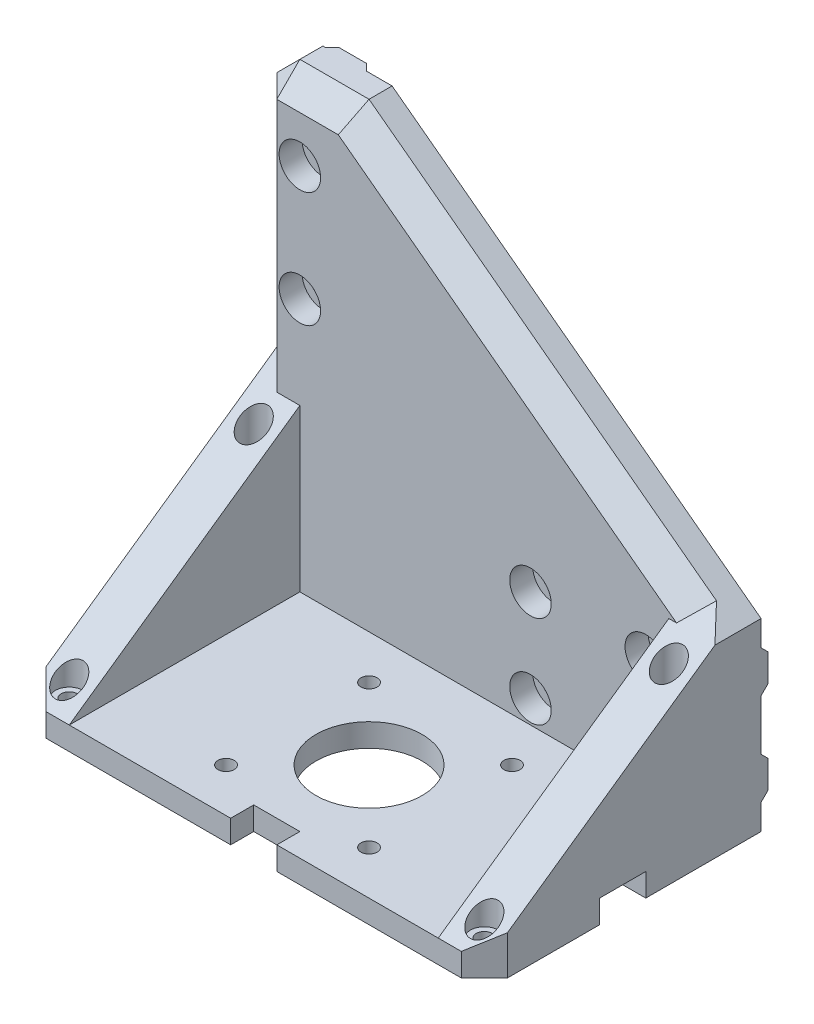
from build123d import *

# Parameters (mm, degrees)
BOSS_EXTRUDE1_DEPTH     = 10
SKETCH2_R               = 2.6
CUT_EXTRUDE1_DEPTH      = 142.774468788
SKETCH3_W               = 60
SKETCH3_H               = 9
SKETCH3_W_2             = 9
SKETCH3_H_2             = 60
BOSS_EXTRUDE3_DEPTH     = 1.46
CUT_EXTRUDE2_DEPTH      = 142.774468788
CUT_EXTRUDE2_DEPTH_BACK = 142.774468788
SKETCH2_2_R             = 2.6
CHAMFER1_SIZE           = 1.46
CUT_EXTRUDE3_START      = 10
SKETCH4_R               = 4.5
CUT_EXTRUDE3_DEPTH      = 5
SKETCH5_W               = 100
SKETCH5_H               = 50
SKETCH5_R               = 11.5
SKETCH5_R_2             = 1.75
BOSS_EXTRUDE4_DEPTH     = 5
BOSS_EXTRUDE5_DEPTH     = 10
BOSS_EXTRUDE6_START     = 100
BOSS_EXTRUDE6_DEPTH     = 10
CUT_EXTRUDE4_DEPTH      = 154.622914957
CUT_EXTRUDE4_DEPTH_BACK = 154.622914957
SKETCH9_R               = 1.75
SKETCH10_W              = 10
SKETCH10_H              = 5
CUT_EXTRUDE5_DEPTH      = 5
CUT_EXTRUDE6_START      = 100
SKETCH10_2_W            = 10
SKETCH10_2_H            = 5
CUT_EXTRUDE6_DEPTH      = 5
CUT_EXTRUDE7_START      = 60
SKETCH11_W              = 10
SKETCH11_H              = 5
CUT_EXTRUDE7_DEPTH      = 5
CUT_EXTRUDE9_START      = 100
SKETCH12_R              = 3
CUT_EXTRUDE9_DEPTH      = 95
CHAMFER2_SIZE           = 5


# Some blends are built 0.0001 mm under size
with BuildPart() as part:
    # Sketch1 → Boss-Extrude1 (new body)
    with BuildSketch(Plane.XY):
        Polygon((0, 0), (100, 0), (100, 40), (20, 100), (0, 100), align=None)
    extrude(amount=BOSS_EXTRUDE1_DEPTH)

    # Sketch2 → Cut-Extrude1 (cut, through all)
    with BuildSketch(Plane.XY):
        with Locations((10, 85)):
            Circle(SKETCH2_R)
        with Locations((10, 60)):
            Circle(SKETCH2_R)
        with Locations((85, 30)):
            Circle(SKETCH2_R)
        with Locations((85, 10)):
            Circle(SKETCH2_R)
        with Locations((60, 10)):
            Circle(SKETCH2_R)
        with Locations((60, 30)):
            Circle(SKETCH2_R)
    extrude(amount=CUT_EXTRUDE1_DEPTH, mode=Mode.SUBTRACT)

    # Sketch3 → Boss-Extrude3 (add)
    with BuildSketch(Plane.XY):
        with Locations((70, 30)):
            Rectangle(SKETCH3_W, SKETCH3_H)
        with Locations((70, 10)):
            Rectangle(SKETCH3_W, SKETCH3_H)
        with Locations((10, 70)):
            Rectangle(SKETCH3_W_2, SKETCH3_H_2)
    extrude(amount=-BOSS_EXTRUDE3_DEPTH)

    # Sketch2<2> → Cut-Extrude2 (cut, two sides: drawn at the far end of the back side and taken through both)
    with BuildSketch(Plane.XY.offset(-CUT_EXTRUDE2_DEPTH_BACK)):
        with Locations((10, 85)):
            Circle(SKETCH2_2_R)
        with Locations((10, 60)):
            Circle(SKETCH2_2_R)
        with Locations((85, 30)):
            Circle(SKETCH2_2_R)
        with Locations((85, 10)):
            Circle(SKETCH2_2_R)
        with Locations((60, 10)):
            Circle(SKETCH2_2_R)
        with Locations((60, 30)):
            Circle(SKETCH2_2_R)
    extrude(amount=CUT_EXTRUDE2_DEPTH + CUT_EXTRUDE2_DEPTH_BACK, mode=Mode.SUBTRACT)

    # Chamfer1
    chamfer1_edges = [part.edges().sort_by_distance(p)[0] for p in [
        (14.5, 70, -1.46),
        (5.5, 70, -1.46),
        (70, 5.5, -1.46),
        (70, 14.5, -1.46),
        (70, 25.5, -1.46),
        (70, 34.5, -1.46),
    ]]
    chamfer(chamfer1_edges, length=CHAMFER1_SIZE - 0.0001)  # a hair under: the kernel refuses the full size

    # Sketch4 → Cut-Extrude3 (cut)
    with BuildSketch(Plane.XY.offset(CUT_EXTRUDE3_START)):
        with Locations((10, 85)):
            Circle(SKETCH4_R)
        with Locations((10, 60)):
            Circle(SKETCH4_R)
        with Locations((60, 30)):
            Circle(SKETCH4_R)
        with Locations((85, 30)):
            Circle(SKETCH4_R)
        with Locations((85, 10)):
            Circle(SKETCH4_R)
        with Locations((60, 10)):
            Circle(SKETCH4_R)
    extrude(amount=-CUT_EXTRUDE3_DEPTH, mode=Mode.SUBTRACT)

    # Sketch5 → Boss-Extrude4 (add)
    with BuildSketch(Plane(origin=(0, 0, 0), x_dir=(1, 0, 0), z_dir=(0, 1, 0))):
        with Locations((50, -35)):
            Rectangle(SKETCH5_W, SKETCH5_H)
        with Locations(Location((50, -35, 0), (0, 0, 270))):
            Circle(SKETCH5_R, mode=Mode.SUBTRACT)
        with Locations(Location((65.5, -50.5, 0), (0, 0, 270))):
            Circle(SKETCH5_R_2, mode=Mode.SUBTRACT)
        with Locations(Location((34.5, -50.5, 0), (0, 0, 270))):
            Circle(SKETCH5_R_2, mode=Mode.SUBTRACT)
        with Locations(Location((34.5, -19.5, 0), (0, 0, 270))):
            Circle(SKETCH5_R_2, mode=Mode.SUBTRACT)
        with Locations(Location((65.5, -19.5, 0), (0, 0, 270))):
            Circle(SKETCH5_R_2, mode=Mode.SUBTRACT)
    extrude(amount=BOSS_EXTRUDE4_DEPTH)

    # Sketch8 → Boss-Extrude5 (add)
    with BuildSketch(Plane(origin=(0, 0, 0), x_dir=(0, 0, -1), z_dir=(1, 0, 0))):
        Polygon((-10, 5), (-60, 5), (-10, 40), align=None)
    extrude(amount=BOSS_EXTRUDE5_DEPTH)

    # Sketch8<2> → Boss-Extrude6 (add)
    with BuildSketch(Plane(origin=(0, 0, 0), x_dir=(0, 0, -1), z_dir=(1, 0, 0)).offset(BOSS_EXTRUDE6_START)):
        Polygon((-10, 5), (-60, 5), (-10, 40), align=None)
    extrude(amount=-BOSS_EXTRUDE6_DEPTH)

    # Sketch9 → Cut-Extrude4 (cut, two sides: drawn at the far end of the back side and taken through both)
    with BuildSketch(Plane(origin=(0, 0, 0), x_dir=(1, 0, 0), z_dir=(0, 1, 0)).offset(-CUT_EXTRUDE4_DEPTH_BACK)):
        with Locations(Location((5, -55, 0), (0, 0, 270))):
            Circle(SKETCH9_R)
        with Locations(Location((95, -55, 0), (0, 0, 270))):
            Circle(SKETCH9_R)
        with Locations(Location((95, -15, 0), (0, 0, 270))):
            Circle(SKETCH9_R)
        with Locations(Location((5, -15, 0), (0, 0, 270))):
            Circle(SKETCH9_R)
    extrude(amount=CUT_EXTRUDE4_DEPTH + CUT_EXTRUDE4_DEPTH_BACK, mode=Mode.SUBTRACT)

    # Sketch10 → Cut-Extrude5 (cut)
    with BuildSketch(Plane(origin=(0, 0, 0), x_dir=(0, 0, -1), z_dir=(1, 0, 0))):
        with Locations((-30, 2.5)):
            Rectangle(SKETCH10_W, SKETCH10_H)
    extrude(amount=CUT_EXTRUDE5_DEPTH, mode=Mode.SUBTRACT)

    # Sketch10<2> → Cut-Extrude6 (cut)
    with BuildSketch(Plane(origin=(0, 0, 0), x_dir=(0, 0, -1), z_dir=(1, 0, 0)).offset(CUT_EXTRUDE6_START)):
        with Locations((-30, 2.5)):
            Rectangle(SKETCH10_2_W, SKETCH10_2_H)
    extrude(amount=-CUT_EXTRUDE6_DEPTH, mode=Mode.SUBTRACT)

    # Sketch11 → Cut-Extrude7 (cut)
    with BuildSketch(Plane.XY.offset(CUT_EXTRUDE7_START)):
        with Locations((50, 2.5)):
            Rectangle(SKETCH11_W, SKETCH11_H)
    extrude(amount=-CUT_EXTRUDE7_DEPTH, mode=Mode.SUBTRACT)

    # Sketch12 → Cut-Extrude9 (cut)
    with BuildSketch(Plane(origin=(0, 0, 0), x_dir=(1, 0, 0), z_dir=(0, 1, 0)).offset(CUT_EXTRUDE9_START)):
        with Locations((5, -15)):
            Circle(SKETCH12_R)
        with Locations((5, -55)):
            Circle(SKETCH12_R)
        with Locations((95, -55)):
            Circle(SKETCH12_R)
        with Locations((95, -15)):
            Circle(SKETCH12_R)
    extrude(amount=-CUT_EXTRUDE9_DEPTH, mode=Mode.SUBTRACT)

    # Chamfer2
    # the kernel refuses this chamfer: 5 mm, written as the material it takes off along each edge
    with BuildSketch(Plane(origin=(3.333333333, 96.666666667, 6.666666667), x_dir=(-0.7071067811865474, 0, -0.7071067811865476), z_dir=(-0.5773502691896258, 0.5773502691896257, 0.5773502691896257))) as chamfer2_piece_1:
        Polygon((-3.535533906, 2.041241452), (3.535533906, 2.041241452), (0, -4.082482905), align=None)
    extrude(amount=6.350852961, mode=Mode.SUBTRACT)
    with BuildSketch(Plane(origin=(110.286731952, 32.284951036, 10), x_dir=(0.016497525966350957, 0.021996701288467948, -0.9996219169112968), z_dir=(-0.8000000000000002, 0.6, 0))) as chamfer2_piece_2_section:
        Polygon((CHAMFER2_SIZE * 0.999621916911, CHAMFER2_SIZE * 0.0274958766106), (-CHAMFER2_SIZE * 0.0274958766106, CHAMFER2_SIZE * 0.999621916911), (0, 0), align=None)
    chamfer2_piece_2 = extrude(amount=125.71682988, mode=Mode.PRIVATE)
    chamfer2_piece_2 = split(chamfer2_piece_2, bisect_by=Plane(origin=(56.438385269, 50.830938552, -5.472769359), z_dir=(0, 0.8192319205190406, 0.5734623443633283)), keep=Keep.TOP, mode=Mode.PRIVATE)
    add(chamfer2_piece_2, mode=Mode.SUBTRACT)
    with BuildSketch(Plane(origin=(100, -12.85841494, 60), x_dir=(0.0274958766105877, 0, -0.9996219169112968), z_dir=(0, 1, 0))) as chamfer2_piece_3:
        Polygon((CHAMFER2_SIZE * 0.999621916911, CHAMFER2_SIZE * 0.0274958766106), (-CHAMFER2_SIZE * 0.0274958766106, CHAMFER2_SIZE * 0.999621916911), (0, 0), align=None)
    extrude(amount=30.71682988, mode=Mode.SUBTRACT)
    with BuildSketch(Plane(origin=(0, -12.85841494, 60), x_dir=(-0.027495876610586372, 0, -0.9996219169112968), z_dir=(0, 1, 0))) as chamfer2_piece_4:
        Polygon((CHAMFER2_SIZE * 0.999621916911, -CHAMFER2_SIZE * 0.0274958766106), (-CHAMFER2_SIZE * 0.0274958766106, -CHAMFER2_SIZE * 0.999621916911), (0, 0), align=None)
    extrude(amount=30.71682988, mode=Mode.SUBTRACT)
    with BuildSketch(Plane(origin=(32.85841494, 100, 10), x_dir=(0, 0.0274958766105877, -0.9996219169112968), z_dir=(-1, 0, 0))) as chamfer2_piece_5:
        Polygon((CHAMFER2_SIZE * 0.999621916911, CHAMFER2_SIZE * 0.0274958766106), (-CHAMFER2_SIZE * 0.0274958766106, CHAMFER2_SIZE * 0.999621916911), (0, 0), align=None)
    extrude(amount=45.71682988, mode=Mode.SUBTRACT)
    with BuildSketch(Plane(origin=(0, 112.85841494, 10), x_dir=(-0.02749587661058638, 0, -0.9996219169112968), z_dir=(0, -1, 0))) as chamfer2_piece_6_section:
        Polygon((CHAMFER2_SIZE * 0.999621916911, CHAMFER2_SIZE * 0.0274958766106), (-CHAMFER2_SIZE * 0.0274958766106, CHAMFER2_SIZE * 0.999621916911), (0, 0), align=None)
    chamfer2_piece_6 = extrude(amount=85.71682988, mode=Mode.PRIVATE)
    chamfer2_piece_6 = split(chamfer2_piece_6, bisect_by=Plane(origin=(1.674929178, 50.830938552, -5.472769359), z_dir=(0, 0.8192319205190406, 0.5734623443633283)), keep=Keep.TOP, mode=Mode.PRIVATE)
    add(chamfer2_piece_6, mode=Mode.SUBTRACT)
    with BuildSketch(Plane(origin=(0, 100, -12.85841494), x_dir=(-0.027495876610586313, -0.9996219169112968, 0), z_dir=(0, 0, 1))) as chamfer2_piece_7:
        Polygon((CHAMFER2_SIZE * 0.999621916911, CHAMFER2_SIZE * 0.0274958766106), (-CHAMFER2_SIZE * 0.0274958766106, CHAMFER2_SIZE * 0.999621916911), (0, 0), align=None)
    extrude(amount=35.71682988, mode=Mode.SUBTRACT)


solid = part.part
